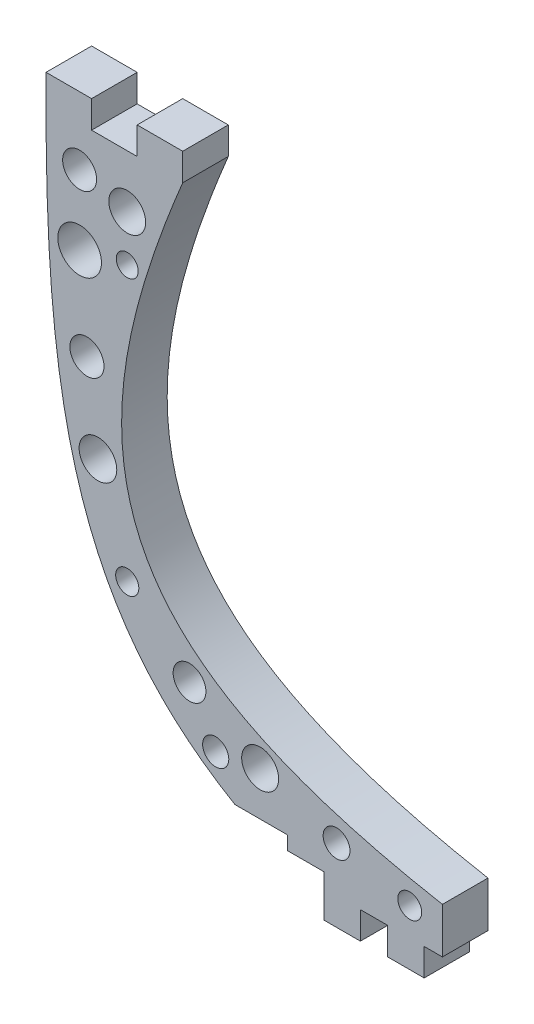
from build123d import *

# Parameters (mm, degrees)
ESQUISSE3_R             = 1.799094092
ESQUISSE3_R_2           = 1.436016343
ESQUISSE3_R_3           = 1.271503072
ESQUISSE3_R_4           = 2.067863533
ESQUISSE3_R_5           = 1.472480674
ESQUISSE3_R_6           = 2.031777992
ESQUISSE3_R_7           = 1.31161039
ESQUISSE3_R_8           = 1.870132193
ESQUISSE3_R_9           = 2.393973193
ESQUISSE3_R_10          = 1.206253728
ESQUISSE3_R_11          = 2.023509578
ESQUISSE3_R_12          = 1.863947
BOSS_EXTRU_1_DEPTH      = 5
ESQUISSE4_W             = 5.770475937
ESQUISSE4_H             = 1.5
ENL_V_MAT_EXTRU_1_DEPTH = 71.775228155


with BuildPart() as part:
    # Esquisse3 → Boss.-Extru.1 (new body)
    with BuildSketch(Plane.XY):
        with BuildLine():
            Line((30, -1.6), (30, -4.6))
            Line((30, -4.6), (34, -4.6))
            Line((34, -4.6), (34, -1.6))
            Line((34, -1.6), (36, -1.6))
            Line((36, -1.6), (36, 3.4))
            add(Edge.make_bspline(
                [(36, 3.4), (-1.275512635, 10.212780912), (-5.567144123, 26.426699492), (7.5, 57.73)],
                knots=[0, 0, 0, 0, 1, 1, 1, 1], degree=3))
            Line((7.5, 57.73), (7.5, 60.73))
            Line((7.5, 60.73), (2.5, 60.73))
            Line((2.5, 60.73), (2.5, 57.73))
            Line((2.5, 57.73), (0, 57.73))
            Line((0, 57.73), (-2.5, 57.73))
            Line((-2.5, 57.73), (-2.5, 60.73))
            Line((-2.5, 60.73), (-7.5, 60.73))
            Line((-7.5, 60.73), (-7.5, 57.73))
            add(Edge.make_bspline(
                [(16, 0), (-3.920324015, 9.982505189), (-7.5, 27.800800799), (-7.5, 57.73)],
                knots=[0, 0, 0, 0, 1, 1, 1, 1], degree=3))
            Line((16, 0), (23, 0))
            Line((23, 0), (23, -4.6))
            Line((23, -4.6), (27, -4.6))
            Line((27, -4.6), (27, -1.6))
            Line((27, -1.6), (30, -1.6))
        make_face()
        with Locations((8.247451688, 10.630885312)):
            Circle(ESQUISSE3_R, mode=Mode.SUBTRACT)
        with Locations((11.119484373, 5.461226479)):
            Circle(ESQUISSE3_R_2, mode=Mode.SUBTRACT)
        with Locations((1.412013898, 16.777035258)):
            Circle(ESQUISSE3_R_3, mode=Mode.SUBTRACT)
        with Locations((-1.804662709, 26.829149655)):
            Circle(ESQUISSE3_R_4, mode=Mode.SUBTRACT)
        with Locations((24.383722678, 3.4)):
            Circle(ESQUISSE3_R_5, mode=Mode.SUBTRACT)
        with Locations((16, 6.322836284)):
            Circle(ESQUISSE3_R_6, mode=Mode.SUBTRACT)
        with Locations((32.413649645, 1.491605314)):
            Circle(ESQUISSE3_R_7, mode=Mode.SUBTRACT)
        with Locations((-3.010916437, 35.962213594)):
            Circle(ESQUISSE3_R_8, mode=Mode.SUBTRACT)
        with Locations((-3.815085589, 45.669684069)):
            Circle(ESQUISSE3_R_9, mode=Mode.SUBTRACT)
        with Locations((1.412013898, 46.875937797)):
            Circle(ESQUISSE3_R_10, mode=Mode.SUBTRACT)
        with Locations((1.412013898, 51.930715323)):
            Circle(ESQUISSE3_R_11, mode=Mode.SUBTRACT)
        with Locations((-3.815085589, 53.309291012)):
            Circle(ESQUISSE3_R_12, mode=Mode.SUBTRACT)
    extrude(amount=BOSS_EXTRU_1_DEPTH)

    # Esquisse4 → Enlèv. mat.-Extru.1 (cut, through all)
    with BuildSketch(Plane.XY.offset(5)):
        with Locations((16.114762031, 0.75)):
            Rectangle(ESQUISSE4_W, ESQUISSE4_H)
    extrude(amount=-ENL_V_MAT_EXTRU_1_DEPTH, mode=Mode.SUBTRACT)


solid = part.part
